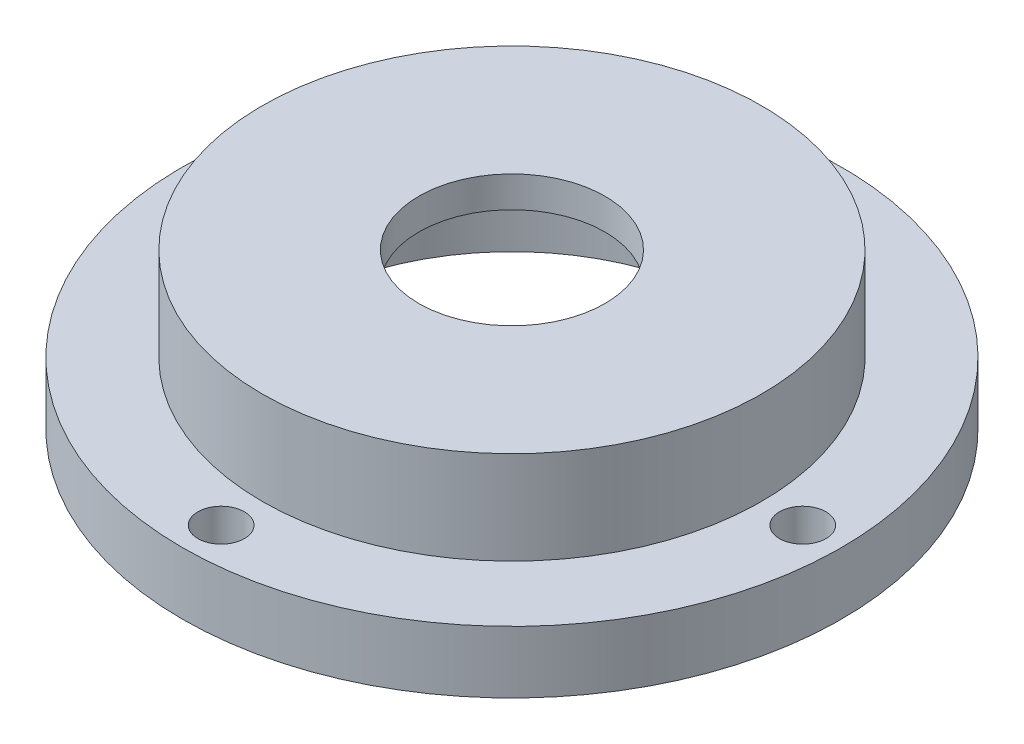
from build123d import *

# Parameters (mm, degrees)
SKETCH_1_R          = 21.25
EXTRUDE_1_DEPTH     = 4
SKETCH_2_R          = 16.1
EXTRUDE_2_DEPTH     = 6
SKETCH_3_R          = 14
CUT_EXTRUDE_3_DEPTH = 8
SKETCH_4_R          = 6
CUT_EXTRUDE_4_DEPTH = 32.672148648
SKETCH_5_R          = 1.5
CUT_EXTRUDE_5_DEPTH = 10


with BuildPart() as part:
    # Эскиз1 → Вытянуть1 (new body)
    with BuildSketch(Plane(origin=(0, 0, 0), x_dir=(1, 0, 0), z_dir=(0, 1, 0))):
        Circle(SKETCH_1_R)
    extrude(amount=EXTRUDE_1_DEPTH)

    # Эскиз2 → Вытянуть2 (add)
    with BuildSketch(Plane(origin=(0, 4, 0), x_dir=(-1, 0, 0), z_dir=(0, 1, 0))):
        Circle(SKETCH_2_R)
    extrude(amount=EXTRUDE_2_DEPTH)

    # Эскиз3 → Вытянуть3 (cut)
    with BuildSketch(Plane.XZ):
        Circle(SKETCH_3_R)
    extrude(amount=-CUT_EXTRUDE_3_DEPTH, mode=Mode.SUBTRACT)

    # Эскиз4 → Вытянуть4 (cut, through all)
    with BuildSketch(Plane(origin=(0, 10, 0), x_dir=(1, 0, 0), z_dir=(0, 1, 0))):
        Circle(SKETCH_4_R)
    extrude(amount=-CUT_EXTRUDE_4_DEPTH, mode=Mode.SUBTRACT)

    # Эскиз5 → Вытянуть5 (cut)
    with BuildSketch(Plane(origin=(0, 4, 0), x_dir=(1, 0, 0), z_dir=(0, 1, 0))):
        with Locations((0, 18.75)):
            Circle(SKETCH_5_R)
        with Locations((18.75, 0)):
            Circle(SKETCH_5_R)
        with Locations((0, -18.75)):
            Circle(SKETCH_5_R)
        with Locations((-18.75, 0)):
            Circle(SKETCH_5_R)
    extrude(amount=-CUT_EXTRUDE_5_DEPTH, mode=Mode.SUBTRACT)


solid = part.part
